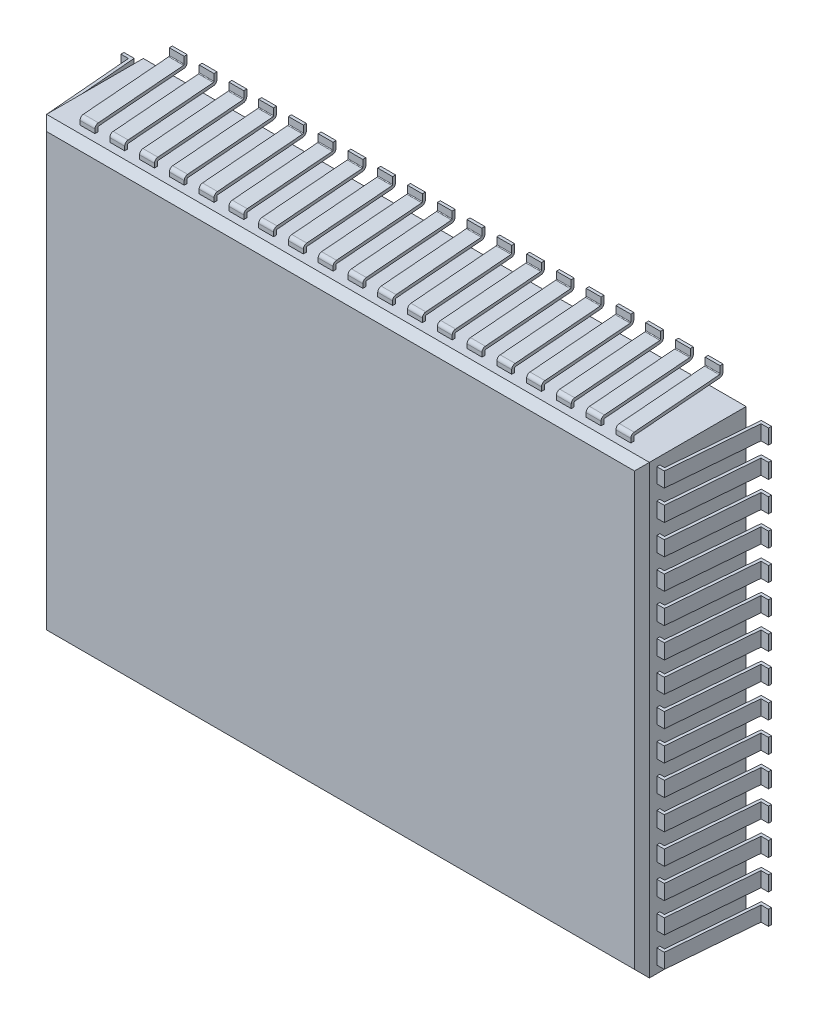
from build123d import *

# Parameters (mm, degrees)
COMPONENT_OUTLINE_W   = 8.1
COMPONENT_OUTLINE_H   = 6
EXTRUDE1_DEPTH        = 1.4
EXTRUDE_THIN1_DEPTH   = 0.1
LPATTERN1_COUNT       = 10
LPATTERN1_PITCH       = 0.4
LPATTERN1_COL_COUNT   = 10
LPATTERN1_COL_PITCH   = 0.4
MIRROR1_COPY_1_DEPTH  = 0.1
MIRROR1_COPY_2_DEPTH  = 0.1
MIRROR1_COPY_3_DEPTH  = 0.1
MIRROR1_COPY_4_DEPTH  = 0.1
MIRROR1_COPY_5_DEPTH  = 0.1
MIRROR1_COPY_6_DEPTH  = 0.1
MIRROR1_COPY_7_DEPTH  = 0.1
MIRROR1_COPY_8_DEPTH  = 0.1
MIRROR1_COPY_9_DEPTH  = 0.1
MIRROR1_COPY_10_DEPTH = 0.1
MIRROR1_COPY_11_DEPTH = 0.1
MIRROR1_COPY_12_DEPTH = 0.1
MIRROR1_COPY_13_DEPTH = 0.1
MIRROR1_COPY_14_DEPTH = 0.1
MIRROR1_COPY_15_DEPTH = 0.1
MIRROR1_COPY_16_DEPTH = 0.1
MIRROR1_COPY_17_DEPTH = 0.1
MIRROR1_COPY_18_DEPTH = 0.1
EXTRUDE_THIN2_DEPTH   = 0.1
LPATTERN2_COUNT       = 8
LPATTERN2_PITCH       = 0.4
LPATTERN2_COL_COUNT   = 8
LPATTERN2_COL_PITCH   = 0.4
MIRROR2_COPY_1_DEPTH  = 0.1
MIRROR2_COPY_2_DEPTH  = 0.1
MIRROR2_COPY_3_DEPTH  = 0.1
MIRROR2_COPY_4_DEPTH  = 0.1
MIRROR2_COPY_5_DEPTH  = 0.1
MIRROR2_COPY_6_DEPTH  = 0.1
MIRROR2_COPY_7_DEPTH  = 0.1
MIRROR2_COPY_8_DEPTH  = 0.1
MIRROR2_COPY_9_DEPTH  = 0.1
MIRROR2_COPY_10_DEPTH = 0.1
MIRROR2_COPY_11_DEPTH = 0.1
MIRROR2_COPY_12_DEPTH = 0.1
MIRROR2_COPY_13_DEPTH = 0.1
MIRROR2_COPY_14_DEPTH = 0.1
CHAMFER1_SIZE         = 0.1


with BuildPart() as part:
    # COMPONENT_OUTLINE → Extrude1 (new body)
    with BuildSketch(Plane.XY):
        Rectangle(COMPONENT_OUTLINE_W, COMPONENT_OUTLINE_H)
    extrude(amount=EXTRUDE1_DEPTH)

    # Sketch1 → Extrude-Thin1 (add, symmetric)
    with BuildSketch(Plane(origin=(0, 0, 0), x_dir=(0, 0, -1), z_dir=(1, 0, 0))):
        with BuildLine():
            Line((-1.2, 3), (-1.2, 3.053993356))
            ThreePointArc((-1.2, 3.053993356), (-1.186794114, 3.08784883), (-1.154152274, 3.103820644))
            Line((-1.154152274, 3.103820644), (-0.009169545, 3.199235871))
            ThreePointArc((-0.009169545, 3.199235871), (-0.002641177, 3.202430234), (0, 3.209201329))
            Line((0, 3.209201329), (0, 3.3))
            Line((0, 3.3), (0.04, 3.3))
            Line((0.04, 3.3), (0.04, 3.209201329))
            ThreePointArc((0.04, 3.209201329), (0.026794114, 3.175345854), (-0.005847726, 3.159374041))
            Line((-0.005847726, 3.159374041), (-1.150830455, 3.063958814))
            ThreePointArc((-1.150830455, 3.063958814), (-1.157358823, 3.060764451), (-1.16, 3.053993356))
            Line((-1.16, 3.053993356), (-1.16, 3))
            Line((-1.16, 3), (-1.2, 3))
        make_face()
    extrude_thin1 = extrude(amount=EXTRUDE_THIN1_DEPTH, both=True)

    # LPattern1: Extrude-Thin1 ×10
    with Locations(*[(-i * LPATTERN1_PITCH, 0, 0) for i in range(1, LPATTERN1_COUNT)]):
        add(extrude_thin1)

    # LPattern1 col: Extrude-Thin1 ×10
    with Locations(*[(i * LPATTERN1_COL_PITCH, 0, 0) for i in range(1, LPATTERN1_COL_COUNT)]):
        add(extrude_thin1)

    # Mirror1: Extrude-Thin1 across plane
    add(extrude_thin1.mirror(Plane.ZX))

    # Mirror1 copy 1 sketch → Mirror1 copy 1 (add, symmetric)
    with BuildSketch(Plane(origin=(-0.4, 0, 0), x_dir=(0, 0, -1), z_dir=(1, 0, 0))):
        with BuildLine():
            Line((-1.2, -3), (-1.2, -3.053993356))
            ThreePointArc((-1.2, -3.053993356), (-1.186794114, -3.08784883), (-1.154152274, -3.103820644))
            Line((-1.154152274, -3.103820644), (-0.009169545, -3.199235871))
            ThreePointArc((-0.009169545, -3.199235871), (-0.002641177, -3.202430234), (0, -3.209201329))
            Line((0, -3.209201329), (0, -3.3))
            Line((0, -3.3), (0.04, -3.3))
            Line((0.04, -3.3), (0.04, -3.209201329))
            ThreePointArc((0.04, -3.209201329), (0.026794114, -3.175345854), (-0.005847726, -3.159374041))
            Line((-0.005847726, -3.159374041), (-1.150830455, -3.063958814))
            ThreePointArc((-1.150830455, -3.063958814), (-1.157358823, -3.060764451), (-1.16, -3.053993356))
            Line((-1.16, -3.053993356), (-1.16, -3))
            Line((-1.16, -3), (-1.2, -3))
        make_face()
    extrude(amount=MIRROR1_COPY_1_DEPTH, both=True)

    # Mirror1 copy 2 sketch → Mirror1 copy 2 (add, symmetric)
    with BuildSketch(Plane(origin=(-0.8, 0, 0), x_dir=(0, 0, -1), z_dir=(1, 0, 0))):
        with BuildLine():
            Line((-1.2, -3), (-1.2, -3.053993356))
            ThreePointArc((-1.2, -3.053993356), (-1.186794114, -3.08784883), (-1.154152274, -3.103820644))
            Line((-1.154152274, -3.103820644), (-0.009169545, -3.199235871))
            ThreePointArc((-0.009169545, -3.199235871), (-0.002641177, -3.202430234), (0, -3.209201329))
            Line((0, -3.209201329), (0, -3.3))
            Line((0, -3.3), (0.04, -3.3))
            Line((0.04, -3.3), (0.04, -3.209201329))
            ThreePointArc((0.04, -3.209201329), (0.026794114, -3.175345854), (-0.005847726, -3.159374041))
            Line((-0.005847726, -3.159374041), (-1.150830455, -3.063958814))
            ThreePointArc((-1.150830455, -3.063958814), (-1.157358823, -3.060764451), (-1.16, -3.053993356))
            Line((-1.16, -3.053993356), (-1.16, -3))
            Line((-1.16, -3), (-1.2, -3))
        make_face()
    extrude(amount=MIRROR1_COPY_2_DEPTH, both=True)

    # Mirror1 copy 3 sketch → Mirror1 copy 3 (add, symmetric)
    with BuildSketch(Plane(origin=(-1.2, 0, 0), x_dir=(0, 0, -1), z_dir=(1, 0, 0))):
        with BuildLine():
            Line((-1.2, -3), (-1.2, -3.053993356))
            ThreePointArc((-1.2, -3.053993356), (-1.186794114, -3.08784883), (-1.154152274, -3.103820644))
            Line((-1.154152274, -3.103820644), (-0.009169545, -3.199235871))
            ThreePointArc((-0.009169545, -3.199235871), (-0.002641177, -3.202430234), (0, -3.209201329))
            Line((0, -3.209201329), (0, -3.3))
            Line((0, -3.3), (0.04, -3.3))
            Line((0.04, -3.3), (0.04, -3.209201329))
            ThreePointArc((0.04, -3.209201329), (0.026794114, -3.175345854), (-0.005847726, -3.159374041))
            Line((-0.005847726, -3.159374041), (-1.150830455, -3.063958814))
            ThreePointArc((-1.150830455, -3.063958814), (-1.157358823, -3.060764451), (-1.16, -3.053993356))
            Line((-1.16, -3.053993356), (-1.16, -3))
            Line((-1.16, -3), (-1.2, -3))
        make_face()
    extrude(amount=MIRROR1_COPY_3_DEPTH, both=True)

    # Mirror1 copy 4 sketch → Mirror1 copy 4 (add, symmetric)
    with BuildSketch(Plane(origin=(-1.6, 0, 0), x_dir=(0, 0, -1), z_dir=(1, 0, 0))):
        with BuildLine():
            Line((-1.2, -3), (-1.2, -3.053993356))
            ThreePointArc((-1.2, -3.053993356), (-1.186794114, -3.08784883), (-1.154152274, -3.103820644))
            Line((-1.154152274, -3.103820644), (-0.009169545, -3.199235871))
            ThreePointArc((-0.009169545, -3.199235871), (-0.002641177, -3.202430234), (0, -3.209201329))
            Line((0, -3.209201329), (0, -3.3))
            Line((0, -3.3), (0.04, -3.3))
            Line((0.04, -3.3), (0.04, -3.209201329))
            ThreePointArc((0.04, -3.209201329), (0.026794114, -3.175345854), (-0.005847726, -3.159374041))
            Line((-0.005847726, -3.159374041), (-1.150830455, -3.063958814))
            ThreePointArc((-1.150830455, -3.063958814), (-1.157358823, -3.060764451), (-1.16, -3.053993356))
            Line((-1.16, -3.053993356), (-1.16, -3))
            Line((-1.16, -3), (-1.2, -3))
        make_face()
    extrude(amount=MIRROR1_COPY_4_DEPTH, both=True)

    # Mirror1 copy 5 sketch → Mirror1 copy 5 (add, symmetric)
    with BuildSketch(Plane(origin=(-2, 0, 0), x_dir=(0, 0, -1), z_dir=(1, 0, 0))):
        with BuildLine():
            Line((-1.2, -3), (-1.2, -3.053993356))
            ThreePointArc((-1.2, -3.053993356), (-1.186794114, -3.08784883), (-1.154152274, -3.103820644))
            Line((-1.154152274, -3.103820644), (-0.009169545, -3.199235871))
            ThreePointArc((-0.009169545, -3.199235871), (-0.002641177, -3.202430234), (0, -3.209201329))
            Line((0, -3.209201329), (0, -3.3))
            Line((0, -3.3), (0.04, -3.3))
            Line((0.04, -3.3), (0.04, -3.209201329))
            ThreePointArc((0.04, -3.209201329), (0.026794114, -3.175345854), (-0.005847726, -3.159374041))
            Line((-0.005847726, -3.159374041), (-1.150830455, -3.063958814))
            ThreePointArc((-1.150830455, -3.063958814), (-1.157358823, -3.060764451), (-1.16, -3.053993356))
            Line((-1.16, -3.053993356), (-1.16, -3))
            Line((-1.16, -3), (-1.2, -3))
        make_face()
    extrude(amount=MIRROR1_COPY_5_DEPTH, both=True)

    # Mirror1 copy 6 sketch → Mirror1 copy 6 (add, symmetric)
    with BuildSketch(Plane(origin=(-2.4, 0, 0), x_dir=(0, 0, -1), z_dir=(1, 0, 0))):
        with BuildLine():
            Line((-1.2, -3), (-1.2, -3.053993356))
            ThreePointArc((-1.2, -3.053993356), (-1.186794114, -3.08784883), (-1.154152274, -3.103820644))
            Line((-1.154152274, -3.103820644), (-0.009169545, -3.199235871))
            ThreePointArc((-0.009169545, -3.199235871), (-0.002641177, -3.202430234), (0, -3.209201329))
            Line((0, -3.209201329), (0, -3.3))
            Line((0, -3.3), (0.04, -3.3))
            Line((0.04, -3.3), (0.04, -3.209201329))
            ThreePointArc((0.04, -3.209201329), (0.026794114, -3.175345854), (-0.005847726, -3.159374041))
            Line((-0.005847726, -3.159374041), (-1.150830455, -3.063958814))
            ThreePointArc((-1.150830455, -3.063958814), (-1.157358823, -3.060764451), (-1.16, -3.053993356))
            Line((-1.16, -3.053993356), (-1.16, -3))
            Line((-1.16, -3), (-1.2, -3))
        make_face()
    extrude(amount=MIRROR1_COPY_6_DEPTH, both=True)

    # Mirror1 copy 7 sketch → Mirror1 copy 7 (add, symmetric)
    with BuildSketch(Plane(origin=(-2.8, 0, 0), x_dir=(0, 0, -1), z_dir=(1, 0, 0))):
        with BuildLine():
            Line((-1.2, -3), (-1.2, -3.053993356))
            ThreePointArc((-1.2, -3.053993356), (-1.186794114, -3.08784883), (-1.154152274, -3.103820644))
            Line((-1.154152274, -3.103820644), (-0.009169545, -3.199235871))
            ThreePointArc((-0.009169545, -3.199235871), (-0.002641177, -3.202430234), (0, -3.209201329))
            Line((0, -3.209201329), (0, -3.3))
            Line((0, -3.3), (0.04, -3.3))
            Line((0.04, -3.3), (0.04, -3.209201329))
            ThreePointArc((0.04, -3.209201329), (0.026794114, -3.175345854), (-0.005847726, -3.159374041))
            Line((-0.005847726, -3.159374041), (-1.150830455, -3.063958814))
            ThreePointArc((-1.150830455, -3.063958814), (-1.157358823, -3.060764451), (-1.16, -3.053993356))
            Line((-1.16, -3.053993356), (-1.16, -3))
            Line((-1.16, -3), (-1.2, -3))
        make_face()
    extrude(amount=MIRROR1_COPY_7_DEPTH, both=True)

    # Mirror1 copy 8 sketch → Mirror1 copy 8 (add, symmetric)
    with BuildSketch(Plane(origin=(-3.2, 0, 0), x_dir=(0, 0, -1), z_dir=(1, 0, 0))):
        with BuildLine():
            Line((-1.2, -3), (-1.2, -3.053993356))
            ThreePointArc((-1.2, -3.053993356), (-1.186794114, -3.08784883), (-1.154152274, -3.103820644))
            Line((-1.154152274, -3.103820644), (-0.009169545, -3.199235871))
            ThreePointArc((-0.009169545, -3.199235871), (-0.002641177, -3.202430234), (0, -3.209201329))
            Line((0, -3.209201329), (0, -3.3))
            Line((0, -3.3), (0.04, -3.3))
            Line((0.04, -3.3), (0.04, -3.209201329))
            ThreePointArc((0.04, -3.209201329), (0.026794114, -3.175345854), (-0.005847726, -3.159374041))
            Line((-0.005847726, -3.159374041), (-1.150830455, -3.063958814))
            ThreePointArc((-1.150830455, -3.063958814), (-1.157358823, -3.060764451), (-1.16, -3.053993356))
            Line((-1.16, -3.053993356), (-1.16, -3))
            Line((-1.16, -3), (-1.2, -3))
        make_face()
    extrude(amount=MIRROR1_COPY_8_DEPTH, both=True)

    # Mirror1 copy 9 sketch → Mirror1 copy 9 (add, symmetric)
    with BuildSketch(Plane(origin=(-3.6, 0, 0), x_dir=(0, 0, -1), z_dir=(1, 0, 0))):
        with BuildLine():
            Line((-1.2, -3), (-1.2, -3.053993356))
            ThreePointArc((-1.2, -3.053993356), (-1.186794114, -3.08784883), (-1.154152274, -3.103820644))
            Line((-1.154152274, -3.103820644), (-0.009169545, -3.199235871))
            ThreePointArc((-0.009169545, -3.199235871), (-0.002641177, -3.202430234), (0, -3.209201329))
            Line((0, -3.209201329), (0, -3.3))
            Line((0, -3.3), (0.04, -3.3))
            Line((0.04, -3.3), (0.04, -3.209201329))
            ThreePointArc((0.04, -3.209201329), (0.026794114, -3.175345854), (-0.005847726, -3.159374041))
            Line((-0.005847726, -3.159374041), (-1.150830455, -3.063958814))
            ThreePointArc((-1.150830455, -3.063958814), (-1.157358823, -3.060764451), (-1.16, -3.053993356))
            Line((-1.16, -3.053993356), (-1.16, -3))
            Line((-1.16, -3), (-1.2, -3))
        make_face()
    extrude(amount=MIRROR1_COPY_9_DEPTH, both=True)

    # Mirror1 copy 10 sketch → Mirror1 copy 10 (add, symmetric)
    with BuildSketch(Plane(origin=(0.4, 0, 0), x_dir=(0, 0, -1), z_dir=(1, 0, 0))):
        with BuildLine():
            Line((-1.2, -3), (-1.2, -3.053993356))
            ThreePointArc((-1.2, -3.053993356), (-1.186794114, -3.08784883), (-1.154152274, -3.103820644))
            Line((-1.154152274, -3.103820644), (-0.009169545, -3.199235871))
            ThreePointArc((-0.009169545, -3.199235871), (-0.002641177, -3.202430234), (0, -3.209201329))
            Line((0, -3.209201329), (0, -3.3))
            Line((0, -3.3), (0.04, -3.3))
            Line((0.04, -3.3), (0.04, -3.209201329))
            ThreePointArc((0.04, -3.209201329), (0.026794114, -3.175345854), (-0.005847726, -3.159374041))
            Line((-0.005847726, -3.159374041), (-1.150830455, -3.063958814))
            ThreePointArc((-1.150830455, -3.063958814), (-1.157358823, -3.060764451), (-1.16, -3.053993356))
            Line((-1.16, -3.053993356), (-1.16, -3))
            Line((-1.16, -3), (-1.2, -3))
        make_face()
    extrude(amount=MIRROR1_COPY_10_DEPTH, both=True)

    # Mirror1 copy 11 sketch → Mirror1 copy 11 (add, symmetric)
    with BuildSketch(Plane(origin=(0.8, 0, 0), x_dir=(0, 0, -1), z_dir=(1, 0, 0))):
        with BuildLine():
            Line((-1.2, -3), (-1.2, -3.053993356))
            ThreePointArc((-1.2, -3.053993356), (-1.186794114, -3.08784883), (-1.154152274, -3.103820644))
            Line((-1.154152274, -3.103820644), (-0.009169545, -3.199235871))
            ThreePointArc((-0.009169545, -3.199235871), (-0.002641177, -3.202430234), (0, -3.209201329))
            Line((0, -3.209201329), (0, -3.3))
            Line((0, -3.3), (0.04, -3.3))
            Line((0.04, -3.3), (0.04, -3.209201329))
            ThreePointArc((0.04, -3.209201329), (0.026794114, -3.175345854), (-0.005847726, -3.159374041))
            Line((-0.005847726, -3.159374041), (-1.150830455, -3.063958814))
            ThreePointArc((-1.150830455, -3.063958814), (-1.157358823, -3.060764451), (-1.16, -3.053993356))
            Line((-1.16, -3.053993356), (-1.16, -3))
            Line((-1.16, -3), (-1.2, -3))
        make_face()
    extrude(amount=MIRROR1_COPY_11_DEPTH, both=True)

    # Mirror1 copy 12 sketch → Mirror1 copy 12 (add, symmetric)
    with BuildSketch(Plane(origin=(1.2, 0, 0), x_dir=(0, 0, -1), z_dir=(1, 0, 0))):
        with BuildLine():
            Line((-1.2, -3), (-1.2, -3.053993356))
            ThreePointArc((-1.2, -3.053993356), (-1.186794114, -3.08784883), (-1.154152274, -3.103820644))
            Line((-1.154152274, -3.103820644), (-0.009169545, -3.199235871))
            ThreePointArc((-0.009169545, -3.199235871), (-0.002641177, -3.202430234), (0, -3.209201329))
            Line((0, -3.209201329), (0, -3.3))
            Line((0, -3.3), (0.04, -3.3))
            Line((0.04, -3.3), (0.04, -3.209201329))
            ThreePointArc((0.04, -3.209201329), (0.026794114, -3.175345854), (-0.005847726, -3.159374041))
            Line((-0.005847726, -3.159374041), (-1.150830455, -3.063958814))
            ThreePointArc((-1.150830455, -3.063958814), (-1.157358823, -3.060764451), (-1.16, -3.053993356))
            Line((-1.16, -3.053993356), (-1.16, -3))
            Line((-1.16, -3), (-1.2, -3))
        make_face()
    extrude(amount=MIRROR1_COPY_12_DEPTH, both=True)

    # Mirror1 copy 13 sketch → Mirror1 copy 13 (add, symmetric)
    with BuildSketch(Plane(origin=(1.6, 0, 0), x_dir=(0, 0, -1), z_dir=(1, 0, 0))):
        with BuildLine():
            Line((-1.2, -3), (-1.2, -3.053993356))
            ThreePointArc((-1.2, -3.053993356), (-1.186794114, -3.08784883), (-1.154152274, -3.103820644))
            Line((-1.154152274, -3.103820644), (-0.009169545, -3.199235871))
            ThreePointArc((-0.009169545, -3.199235871), (-0.002641177, -3.202430234), (0, -3.209201329))
            Line((0, -3.209201329), (0, -3.3))
            Line((0, -3.3), (0.04, -3.3))
            Line((0.04, -3.3), (0.04, -3.209201329))
            ThreePointArc((0.04, -3.209201329), (0.026794114, -3.175345854), (-0.005847726, -3.159374041))
            Line((-0.005847726, -3.159374041), (-1.150830455, -3.063958814))
            ThreePointArc((-1.150830455, -3.063958814), (-1.157358823, -3.060764451), (-1.16, -3.053993356))
            Line((-1.16, -3.053993356), (-1.16, -3))
            Line((-1.16, -3), (-1.2, -3))
        make_face()
    extrude(amount=MIRROR1_COPY_13_DEPTH, both=True)

    # Mirror1 copy 14 sketch → Mirror1 copy 14 (add, symmetric)
    with BuildSketch(Plane(origin=(2, 0, 0), x_dir=(0, 0, -1), z_dir=(1, 0, 0))):
        with BuildLine():
            Line((-1.2, -3), (-1.2, -3.053993356))
            ThreePointArc((-1.2, -3.053993356), (-1.186794114, -3.08784883), (-1.154152274, -3.103820644))
            Line((-1.154152274, -3.103820644), (-0.009169545, -3.199235871))
            ThreePointArc((-0.009169545, -3.199235871), (-0.002641177, -3.202430234), (0, -3.209201329))
            Line((0, -3.209201329), (0, -3.3))
            Line((0, -3.3), (0.04, -3.3))
            Line((0.04, -3.3), (0.04, -3.209201329))
            ThreePointArc((0.04, -3.209201329), (0.026794114, -3.175345854), (-0.005847726, -3.159374041))
            Line((-0.005847726, -3.159374041), (-1.150830455, -3.063958814))
            ThreePointArc((-1.150830455, -3.063958814), (-1.157358823, -3.060764451), (-1.16, -3.053993356))
            Line((-1.16, -3.053993356), (-1.16, -3))
            Line((-1.16, -3), (-1.2, -3))
        make_face()
    extrude(amount=MIRROR1_COPY_14_DEPTH, both=True)

    # Mirror1 copy 15 sketch → Mirror1 copy 15 (add, symmetric)
    with BuildSketch(Plane(origin=(2.4, 0, 0), x_dir=(0, 0, -1), z_dir=(1, 0, 0))):
        with BuildLine():
            Line((-1.2, -3), (-1.2, -3.053993356))
            ThreePointArc((-1.2, -3.053993356), (-1.186794114, -3.08784883), (-1.154152274, -3.103820644))
            Line((-1.154152274, -3.103820644), (-0.009169545, -3.199235871))
            ThreePointArc((-0.009169545, -3.199235871), (-0.002641177, -3.202430234), (0, -3.209201329))
            Line((0, -3.209201329), (0, -3.3))
            Line((0, -3.3), (0.04, -3.3))
            Line((0.04, -3.3), (0.04, -3.209201329))
            ThreePointArc((0.04, -3.209201329), (0.026794114, -3.175345854), (-0.005847726, -3.159374041))
            Line((-0.005847726, -3.159374041), (-1.150830455, -3.063958814))
            ThreePointArc((-1.150830455, -3.063958814), (-1.157358823, -3.060764451), (-1.16, -3.053993356))
            Line((-1.16, -3.053993356), (-1.16, -3))
            Line((-1.16, -3), (-1.2, -3))
        make_face()
    extrude(amount=MIRROR1_COPY_15_DEPTH, both=True)

    # Mirror1 copy 16 sketch → Mirror1 copy 16 (add, symmetric)
    with BuildSketch(Plane(origin=(2.8, 0, 0), x_dir=(0, 0, -1), z_dir=(1, 0, 0))):
        with BuildLine():
            Line((-1.2, -3), (-1.2, -3.053993356))
            ThreePointArc((-1.2, -3.053993356), (-1.186794114, -3.08784883), (-1.154152274, -3.103820644))
            Line((-1.154152274, -3.103820644), (-0.009169545, -3.199235871))
            ThreePointArc((-0.009169545, -3.199235871), (-0.002641177, -3.202430234), (0, -3.209201329))
            Line((0, -3.209201329), (0, -3.3))
            Line((0, -3.3), (0.04, -3.3))
            Line((0.04, -3.3), (0.04, -3.209201329))
            ThreePointArc((0.04, -3.209201329), (0.026794114, -3.175345854), (-0.005847726, -3.159374041))
            Line((-0.005847726, -3.159374041), (-1.150830455, -3.063958814))
            ThreePointArc((-1.150830455, -3.063958814), (-1.157358823, -3.060764451), (-1.16, -3.053993356))
            Line((-1.16, -3.053993356), (-1.16, -3))
            Line((-1.16, -3), (-1.2, -3))
        make_face()
    extrude(amount=MIRROR1_COPY_16_DEPTH, both=True)

    # Mirror1 copy 17 sketch → Mirror1 copy 17 (add, symmetric)
    with BuildSketch(Plane(origin=(3.2, 0, 0), x_dir=(0, 0, -1), z_dir=(1, 0, 0))):
        with BuildLine():
            Line((-1.2, -3), (-1.2, -3.053993356))
            ThreePointArc((-1.2, -3.053993356), (-1.186794114, -3.08784883), (-1.154152274, -3.103820644))
            Line((-1.154152274, -3.103820644), (-0.009169545, -3.199235871))
            ThreePointArc((-0.009169545, -3.199235871), (-0.002641177, -3.202430234), (0, -3.209201329))
            Line((0, -3.209201329), (0, -3.3))
            Line((0, -3.3), (0.04, -3.3))
            Line((0.04, -3.3), (0.04, -3.209201329))
            ThreePointArc((0.04, -3.209201329), (0.026794114, -3.175345854), (-0.005847726, -3.159374041))
            Line((-0.005847726, -3.159374041), (-1.150830455, -3.063958814))
            ThreePointArc((-1.150830455, -3.063958814), (-1.157358823, -3.060764451), (-1.16, -3.053993356))
            Line((-1.16, -3.053993356), (-1.16, -3))
            Line((-1.16, -3), (-1.2, -3))
        make_face()
    extrude(amount=MIRROR1_COPY_17_DEPTH, both=True)

    # Mirror1 copy 18 sketch → Mirror1 copy 18 (add, symmetric)
    with BuildSketch(Plane(origin=(3.6, 0, 0), x_dir=(0, 0, -1), z_dir=(1, 0, 0))):
        with BuildLine():
            Line((-1.2, -3), (-1.2, -3.053993356))
            ThreePointArc((-1.2, -3.053993356), (-1.186794114, -3.08784883), (-1.154152274, -3.103820644))
            Line((-1.154152274, -3.103820644), (-0.009169545, -3.199235871))
            ThreePointArc((-0.009169545, -3.199235871), (-0.002641177, -3.202430234), (0, -3.209201329))
            Line((0, -3.209201329), (0, -3.3))
            Line((0, -3.3), (0.04, -3.3))
            Line((0.04, -3.3), (0.04, -3.209201329))
            ThreePointArc((0.04, -3.209201329), (0.026794114, -3.175345854), (-0.005847726, -3.159374041))
            Line((-0.005847726, -3.159374041), (-1.150830455, -3.063958814))
            ThreePointArc((-1.150830455, -3.063958814), (-1.157358823, -3.060764451), (-1.16, -3.053993356))
            Line((-1.16, -3.053993356), (-1.16, -3))
            Line((-1.16, -3), (-1.2, -3))
        make_face()
    extrude(amount=MIRROR1_COPY_18_DEPTH, both=True)

    # Sketch2 → Extrude-Thin2 (add, symmetric)
    with BuildSketch(Plane(origin=(0, 0, 0), x_dir=(1, 0, 0), z_dir=(0, 1, 0))):
        Polygon((4.05, -1.2), (4.15, -1.2), (4.25, 0), (4.35, 0), (4.35, 0.04), (4.213194685, 0.04), (4.113194685, -1.16), (4.05, -1.16), align=None)
    extrude_thin2 = extrude(amount=EXTRUDE_THIN2_DEPTH, both=True)

    # LPattern2: Extrude-Thin2 ×8
    with Locations(*[(0, i * LPATTERN2_PITCH, 0) for i in range(1, LPATTERN2_COUNT)]):
        add(extrude_thin2)

    # LPattern2 col: Extrude-Thin2 ×8
    with Locations(*[(0, -i * LPATTERN2_COL_PITCH, 0) for i in range(1, LPATTERN2_COL_COUNT)]):
        add(extrude_thin2)

    # Mirror2: Extrude-Thin2 across plane
    add(extrude_thin2.mirror(Plane(origin=(0, 0, 0), x_dir=(0, 0, 1), z_dir=(1, 0, 0))))

    # Mirror2 copy 1 sketch → Mirror2 copy 1 (add, symmetric)
    with BuildSketch(Plane(origin=(0, 0.4, 0), x_dir=(-1, 0, 0), z_dir=(0, 1, 0))):
        Polygon((4.05, 1.2), (4.15, 1.2), (4.25, 0), (4.35, 0), (4.35, -0.04), (4.213194685, -0.04), (4.113194685, 1.16), (4.05, 1.16), align=None)
    extrude(amount=MIRROR2_COPY_1_DEPTH, both=True)

    # Mirror2 copy 2 sketch → Mirror2 copy 2 (add, symmetric)
    with BuildSketch(Plane(origin=(0, 0.8, 0), x_dir=(-1, 0, 0), z_dir=(0, 1, 0))):
        Polygon((4.05, 1.2), (4.15, 1.2), (4.25, 0), (4.35, 0), (4.35, -0.04), (4.213194685, -0.04), (4.113194685, 1.16), (4.05, 1.16), align=None)
    extrude(amount=MIRROR2_COPY_2_DEPTH, both=True)

    # Mirror2 copy 3 sketch → Mirror2 copy 3 (add, symmetric)
    with BuildSketch(Plane(origin=(0, 1.2, 0), x_dir=(-1, 0, 0), z_dir=(0, 1, 0))):
        Polygon((4.05, 1.2), (4.15, 1.2), (4.25, 0), (4.35, 0), (4.35, -0.04), (4.213194685, -0.04), (4.113194685, 1.16), (4.05, 1.16), align=None)
    extrude(amount=MIRROR2_COPY_3_DEPTH, both=True)

    # Mirror2 copy 4 sketch → Mirror2 copy 4 (add, symmetric)
    with BuildSketch(Plane(origin=(0, 1.6, 0), x_dir=(-1, 0, 0), z_dir=(0, 1, 0))):
        Polygon((4.05, 1.2), (4.15, 1.2), (4.25, 0), (4.35, 0), (4.35, -0.04), (4.213194685, -0.04), (4.113194685, 1.16), (4.05, 1.16), align=None)
    extrude(amount=MIRROR2_COPY_4_DEPTH, both=True)

    # Mirror2 copy 5 sketch → Mirror2 copy 5 (add, symmetric)
    with BuildSketch(Plane(origin=(0, 2, 0), x_dir=(-1, 0, 0), z_dir=(0, 1, 0))):
        Polygon((4.05, 1.2), (4.15, 1.2), (4.25, 0), (4.35, 0), (4.35, -0.04), (4.213194685, -0.04), (4.113194685, 1.16), (4.05, 1.16), align=None)
    extrude(amount=MIRROR2_COPY_5_DEPTH, both=True)

    # Mirror2 copy 6 sketch → Mirror2 copy 6 (add, symmetric)
    with BuildSketch(Plane(origin=(0, 2.4, 0), x_dir=(-1, 0, 0), z_dir=(0, 1, 0))):
        Polygon((4.05, 1.2), (4.15, 1.2), (4.25, 0), (4.35, 0), (4.35, -0.04), (4.213194685, -0.04), (4.113194685, 1.16), (4.05, 1.16), align=None)
    extrude(amount=MIRROR2_COPY_6_DEPTH, both=True)

    # Mirror2 copy 7 sketch → Mirror2 copy 7 (add, symmetric)
    with BuildSketch(Plane(origin=(0, 2.8, 0), x_dir=(-1, 0, 0), z_dir=(0, 1, 0))):
        Polygon((4.05, 1.2), (4.15, 1.2), (4.25, 0), (4.35, 0), (4.35, -0.04), (4.213194685, -0.04), (4.113194685, 1.16), (4.05, 1.16), align=None)
    extrude(amount=MIRROR2_COPY_7_DEPTH, both=True)

    # Mirror2 copy 8 sketch → Mirror2 copy 8 (add, symmetric)
    with BuildSketch(Plane(origin=(0, -0.4, 0), x_dir=(-1, 0, 0), z_dir=(0, 1, 0))):
        Polygon((4.05, 1.2), (4.15, 1.2), (4.25, 0), (4.35, 0), (4.35, -0.04), (4.213194685, -0.04), (4.113194685, 1.16), (4.05, 1.16), align=None)
    extrude(amount=MIRROR2_COPY_8_DEPTH, both=True)

    # Mirror2 copy 9 sketch → Mirror2 copy 9 (add, symmetric)
    with BuildSketch(Plane(origin=(0, -0.8, 0), x_dir=(-1, 0, 0), z_dir=(0, 1, 0))):
        Polygon((4.05, 1.2), (4.15, 1.2), (4.25, 0), (4.35, 0), (4.35, -0.04), (4.213194685, -0.04), (4.113194685, 1.16), (4.05, 1.16), align=None)
    extrude(amount=MIRROR2_COPY_9_DEPTH, both=True)

    # Mirror2 copy 10 sketch → Mirror2 copy 10 (add, symmetric)
    with BuildSketch(Plane(origin=(0, -1.2, 0), x_dir=(-1, 0, 0), z_dir=(0, 1, 0))):
        Polygon((4.05, 1.2), (4.15, 1.2), (4.25, 0), (4.35, 0), (4.35, -0.04), (4.213194685, -0.04), (4.113194685, 1.16), (4.05, 1.16), align=None)
    extrude(amount=MIRROR2_COPY_10_DEPTH, both=True)

    # Mirror2 copy 11 sketch → Mirror2 copy 11 (add, symmetric)
    with BuildSketch(Plane(origin=(0, -1.6, 0), x_dir=(-1, 0, 0), z_dir=(0, 1, 0))):
        Polygon((4.05, 1.2), (4.15, 1.2), (4.25, 0), (4.35, 0), (4.35, -0.04), (4.213194685, -0.04), (4.113194685, 1.16), (4.05, 1.16), align=None)
    extrude(amount=MIRROR2_COPY_11_DEPTH, both=True)

    # Mirror2 copy 12 sketch → Mirror2 copy 12 (add, symmetric)
    with BuildSketch(Plane(origin=(0, -2, 0), x_dir=(-1, 0, 0), z_dir=(0, 1, 0))):
        Polygon((4.05, 1.2), (4.15, 1.2), (4.25, 0), (4.35, 0), (4.35, -0.04), (4.213194685, -0.04), (4.113194685, 1.16), (4.05, 1.16), align=None)
    extrude(amount=MIRROR2_COPY_12_DEPTH, both=True)

    # Mirror2 copy 13 sketch → Mirror2 copy 13 (add, symmetric)
    with BuildSketch(Plane(origin=(0, -2.4, 0), x_dir=(-1, 0, 0), z_dir=(0, 1, 0))):
        Polygon((4.05, 1.2), (4.15, 1.2), (4.25, 0), (4.35, 0), (4.35, -0.04), (4.213194685, -0.04), (4.113194685, 1.16), (4.05, 1.16), align=None)
    extrude(amount=MIRROR2_COPY_13_DEPTH, both=True)

    # Mirror2 copy 14 sketch → Mirror2 copy 14 (add, symmetric)
    with BuildSketch(Plane(origin=(0, -2.8, 0), x_dir=(-1, 0, 0), z_dir=(0, 1, 0))):
        Polygon((4.05, 1.2), (4.15, 1.2), (4.25, 0), (4.35, 0), (4.35, -0.04), (4.213194685, -0.04), (4.113194685, 1.16), (4.05, 1.16), align=None)
    extrude(amount=MIRROR2_COPY_14_DEPTH, both=True)

    # Chamfer1
    chamfer1_edges = [part.edges().sort_by_distance(p)[0] for p in [
        (0, -3, 1.4),
        (4.05, 0, 1.4),
        (0, 3, 1.4),
        (-4.05, 0, 1.4),
    ]]
    chamfer(chamfer1_edges, length=CHAMFER1_SIZE)


solid = part.part
